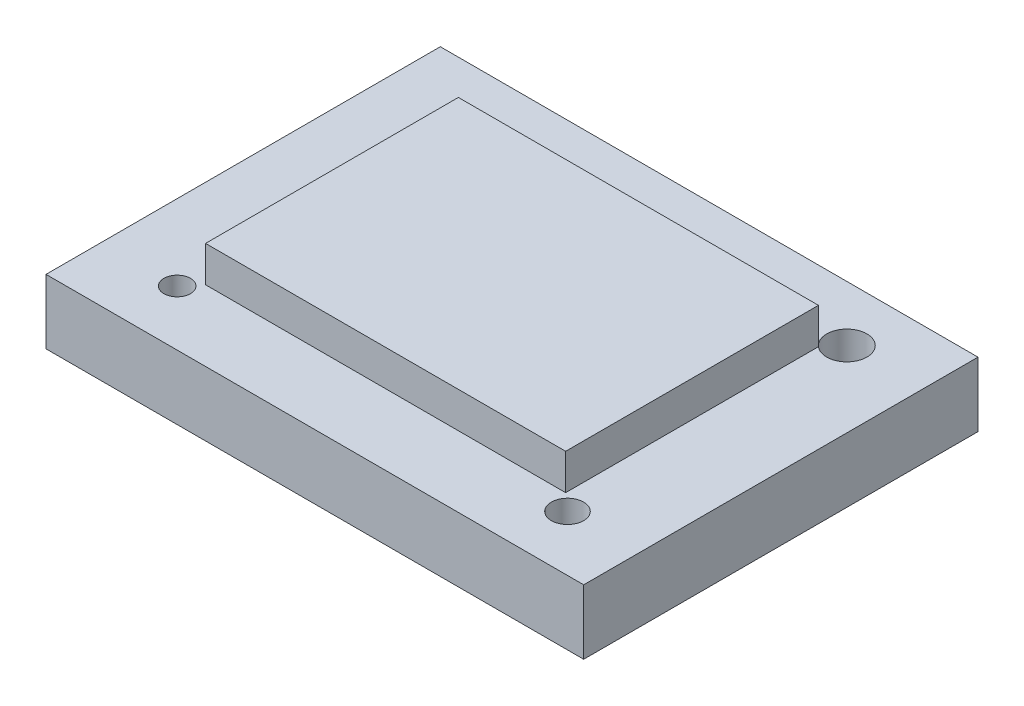
from build123d import *

# Parameters (mm, degrees)
F_01_BASE_PROFILE_W           = 150
F_01_BASE_PROFILE_H           = 110
F_01_BASE_PROFILE_R           = 3.711604984
F_01_BASE_PROFILE_R_2         = 4.5
F_01_BASE_PROFILE_R_3         = 1.223591395
F_01_BASE_PROFILE_R_4         = 5.612716763
F_01_BASE_PROFILE_W_2         = 70
F_01_BASE_PROFILE_H_2         = 24
F_01_BASE_EXTRUDE_DEPTH       = 18
F_02_BOSS_PROFILE_W           = 100.452577252
F_02_BOSS_PROFILE_H           = 70.52593178
F_02_REINFORCEMENT_BOSS_DEPTH = 28


with BuildPart() as part:
    # 01_Base_Profile → 01_Base_Extrude (new body)
    with BuildSketch(Plane(origin=(0, 0, 0), x_dir=(1, 0, 0), z_dir=(0, 1, 0))):
        Rectangle(F_01_BASE_PROFILE_W, F_01_BASE_PROFILE_H)
        with Locations((-53.887283237, -39.51734104)):
            Circle(F_01_BASE_PROFILE_R, mode=Mode.SUBTRACT)
        with Locations((55, -39.51734104)):
            Circle(F_01_BASE_PROFILE_R_2, mode=Mode.SUBTRACT)
        with Locations((-53.887283237, 38)):
            Circle(F_01_BASE_PROFILE_R_3, mode=Mode.SUBTRACT)
        with Locations((53.887283237, 39.51734104)):
            Circle(F_01_BASE_PROFILE_R_4, mode=Mode.SUBTRACT)
        Rectangle(F_01_BASE_PROFILE_W_2, F_01_BASE_PROFILE_H_2, mode=Mode.SUBTRACT)
    extrude(amount=F_01_BASE_EXTRUDE_DEPTH)

    # 02_Boss_Profile → 02_Reinforcement_Boss (add)
    with BuildSketch(Plane(origin=(0, 0, 0), x_dir=(1, 0, 0), z_dir=(0, 1, 0))):
        Rectangle(F_02_BOSS_PROFILE_W, F_02_BOSS_PROFILE_H)
    extrude(amount=F_02_REINFORCEMENT_BOSS_DEPTH)


solid = part.part
